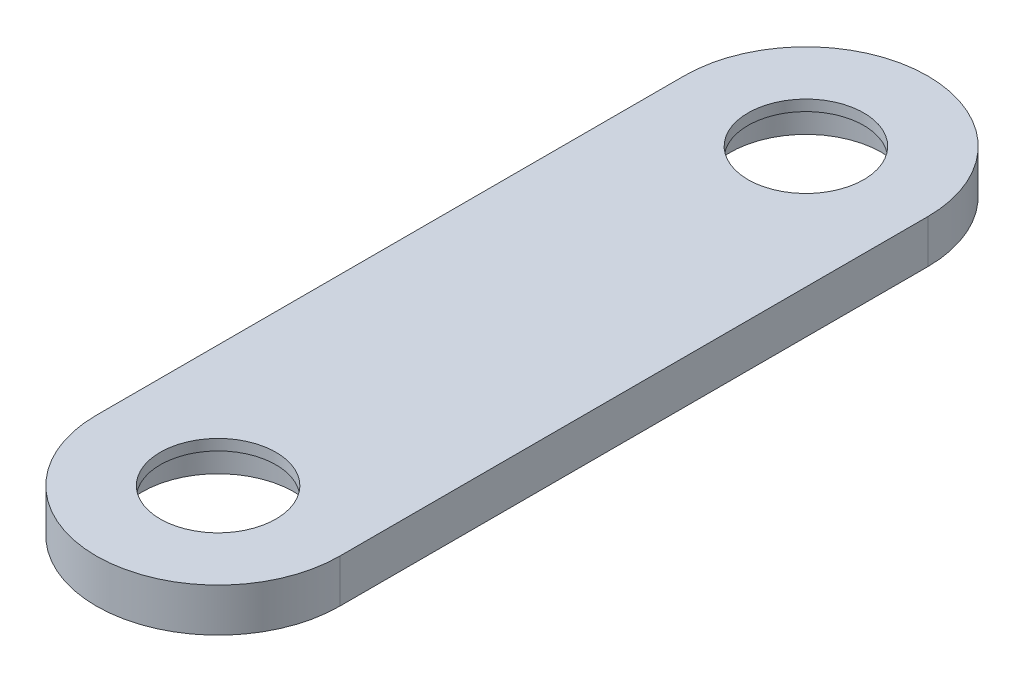
from build123d import *

# Parameters (mm, degrees)
SKETCH1_R           = 10.499999955
BOSS_EXTRUDE1_DEPTH = 12
SKETCH2_R           = 10.499999955
CUT_EXTRUDE1_DEPTH  = 6
BOSS_EXTRUDE2_START = -1.5
SKETCH3_R           = 10.499999955
SKETCH3_R_2         = 8
BOSS_EXTRUDE2_DEPTH = 1.5
SKETCH4_W           = 40.64
SKETCH4_H           = 6
CUT_EXTRUDE2_DEPTH  = 105.447053023


with BuildPart() as part:
    # Sketch1 → Boss-Extrude1 (new body)
    with BuildSketch(Plane(origin=(0, 0, 0), x_dir=(1, 0, 0), z_dir=(0, 1, 0))):
        with BuildLine():
            Line((-16.849999955, 0), (-16.849999955, 81.28))
            ThreePointArc((-16.849999955, 81.28), (0, 98.129999955), (16.849999955, 81.28))
            Line((16.849999955, 81.28), (16.849999955, 0))
            ThreePointArc((16.849999955, 0), (0, -16.849999955), (-16.849999955, 0))
        make_face()
        Circle(SKETCH1_R, mode=Mode.SUBTRACT)
        with Locations((0, 81.28)):
            Circle(SKETCH1_R, mode=Mode.SUBTRACT)
    extrude(amount=BOSS_EXTRUDE1_DEPTH)

    # Sketch2 → Cut-Extrude1 (cut)
    # profile 1 of 2: a face of its own
    with BuildSketch(Plane.XZ):
        with BuildLine():
            Line((-16.849999955, -60.96), (-16.849999955, -81.28))
            ThreePointArc((-16.849999955, -81.28), (0, -98.129999955), (16.849999955, -81.28))
            Line((16.849999955, -81.28), (16.849999955, -60.96))
            Line((16.849999955, -60.96), (-16.849999955, -60.96))
        make_face()
        with Locations((0, -81.28)):
            Circle(SKETCH2_R, mode=Mode.SUBTRACT)
    # profile 2 of 2: a face of its own
    with BuildSketch(Plane.XZ):
        with BuildLine():
            Line((-16.849999955, 0), (-16.849999955, -20.32))
            Line((-16.849999955, -20.32), (16.849999955, -20.32))
            Line((16.849999955, -20.32), (16.849999955, 0))
            ThreePointArc((16.849999955, 0), (0, 16.849999955), (-16.849999955, 0))
        make_face()
    extrude(amount=-CUT_EXTRUDE1_DEPTH, mode=Mode.SUBTRACT)

    # Sketch3 → Boss-Extrude2 (add)
    # profile 1 of 2: a face of its own
    with BuildSketch(Plane(origin=(0, 12, 0), x_dir=(1, 0, 0), z_dir=(0, 1, 0)).offset(BOSS_EXTRUDE2_START)):
        with Locations((0, 81.28)):
            Circle(SKETCH3_R)
        with Locations((0, 81.28)):
            Circle(SKETCH3_R_2, mode=Mode.SUBTRACT)
    # profile 2 of 2: a face of its own
    with BuildSketch(Plane(origin=(0, 12, 0), x_dir=(1, 0, 0), z_dir=(0, 1, 0)).offset(BOSS_EXTRUDE2_START)):
        Circle(SKETCH3_R)
        Circle(SKETCH3_R_2, mode=Mode.SUBTRACT)
    extrude(amount=BOSS_EXTRUDE2_DEPTH)

    # Sketch4 → Cut-Extrude2 (cut, through all)
    with BuildSketch(Plane.ZY.offset(16.849999955)):
        with Locations((-40.64, 3)):
            Rectangle(SKETCH4_W, SKETCH4_H)
    extrude(amount=-CUT_EXTRUDE2_DEPTH, mode=Mode.SUBTRACT)


solid = part.part
